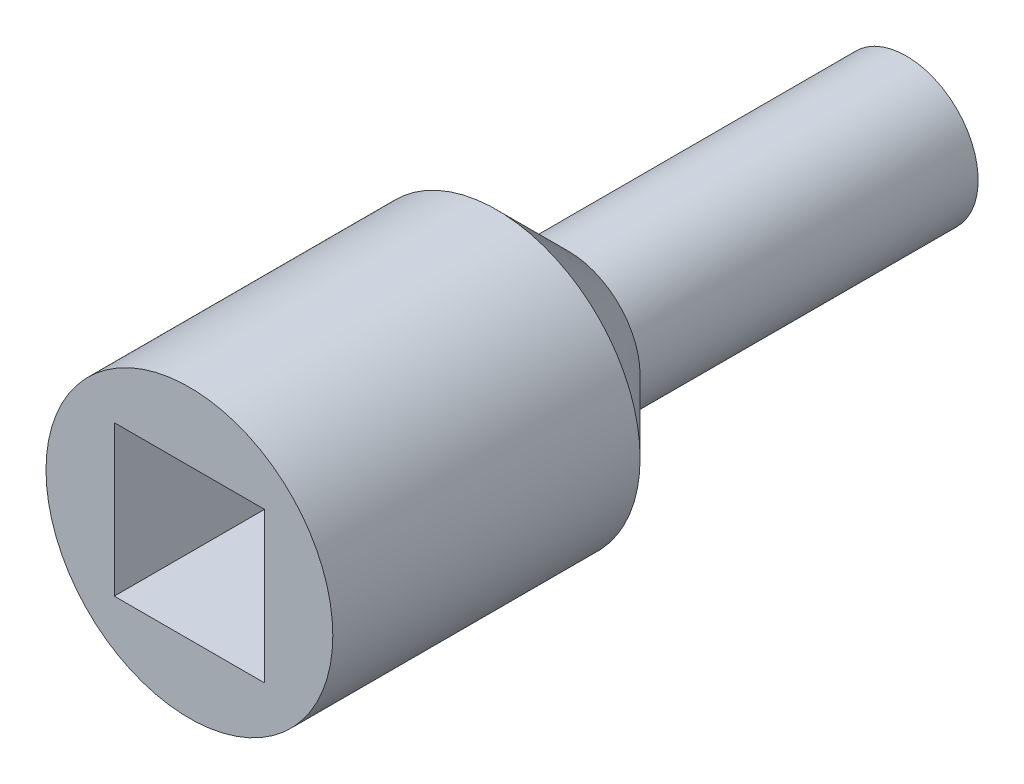
from build123d import *

# Parameters (mm, degrees)
BOSS_EXTRUDE1_DEPTH    = 10
SKETCH2_R              = 3.5
BOSS_EXTRUDE2_DEPTH    = 7.5
SKETCH3_W              = 3.66759605
SKETCH3_H              = 3.66756905
CUT_EXTRUDE1_DEPTH     = 5
BOSS_EXTRUDE3_REACH    = 20.187
CUT_EXTRUDE4_OUTLINE_W = 1.75
CUT_EXTRUDE4_OUTLINE_H = 10


# Read off the part's stored shape, not the designer's step: Cut-Extrude4
with BuildPart() as part:
    # Sketch1 → Boss-Extrude1 (new body)
    with BuildSketch(Plane.XY):
        with BuildLine():
            ThreePointArc((-2.449489743, 2.5), (0, -3.5), (2.449489743, 2.5))
            ThreePointArc((2.449489743, 2.5), (0, 3.5), (-2.449489743, 2.5))
        make_face()
        with BuildLine():
            Line((-2, 1.5), (2, 1.5))
            ThreePointArc((2, 1.5), (0, -2.5), (-2, 1.5))
        make_face(mode=Mode.SUBTRACT)
    extrude(amount=BOSS_EXTRUDE1_DEPTH)

    # Sketch2 → Boss-Extrude2 (add)
    with BuildSketch(Plane.XY.offset(10)):
        Circle(SKETCH2_R)
    extrude(amount=BOSS_EXTRUDE2_DEPTH)

    # Sketch3 → Cut-Extrude1 (cut)
    with BuildSketch(Plane.XY.offset(17.5)):
        Rectangle(SKETCH3_W, SKETCH3_H)
    extrude(amount=-CUT_EXTRUDE1_DEPTH, mode=Mode.SUBTRACT)

    # Sketch1<2> → Boss-Extrude3 (add, up to next)
    with BuildSketch(Plane.XY, mode=Mode.PRIVATE) as boss_extrude3_sk1:
        with BuildLine():
            Line((-2, 1.5), (2, 1.5))
            ThreePointArc((2, 1.5), (0, -2.5), (-2, 1.5))
        make_face()
    boss_extrude3_tool1 = extrude(boss_extrude3_sk1.sketch, amount=BOSS_EXTRUDE3_REACH, mode=Mode.PRIVATE) - part.part
    add(boss_extrude3_tool1.solids().sort_by_distance((0, -0.316718, 0))[0])

    # Cut-Extrude4 outline → Cut-Extrude4 (revolve, cut)
    with BuildSketch(Plane.XZ):
        with Locations((2.625, 5)):
            Rectangle(CUT_EXTRUDE4_OUTLINE_W, CUT_EXTRUDE4_OUTLINE_H)
    revolve(axis=Axis((0, 0, 0), (0, 0, 1)), mode=Mode.SUBTRACT)

    # Sketch6 → Revolve1 (revolve)
    with BuildSketch(Plane(origin=(0, 0, 0), x_dir=(1, 0, 0), z_dir=(0, 1, 0))):
        Polygon((-3.5, -10), (-1.75, -10), (-1.75, -8.25), align=None)
    revolve(axis=Axis((0, 0, 10), (0, 0, -1)))


solid = part.part
